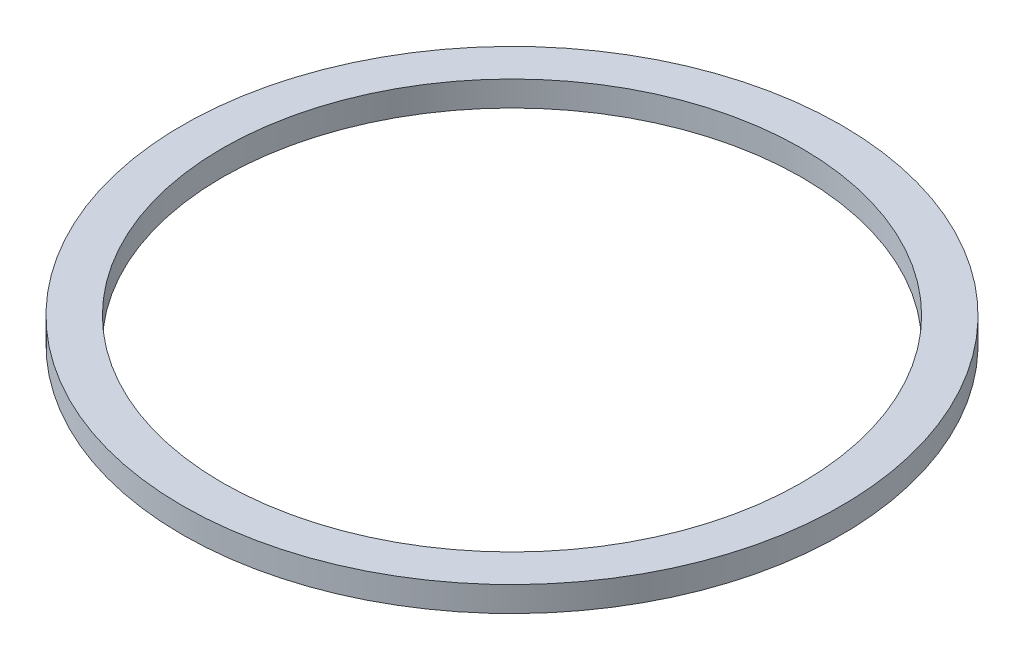
from build123d import *

# Parameters (mm, degrees)
SKETCH1_R           = 111.5
SKETCH1_R_2         = 98
BOSS_EXTRUDE1_DEPTH = 8.5


with BuildPart() as part:
    # Sketch1 → Boss-Extrude1 (new body)
    with BuildSketch(Plane(origin=(0, 0, 0), x_dir=(1, 0, 0), z_dir=(0, 1, 0))):
        Circle(SKETCH1_R)
        Circle(SKETCH1_R_2, mode=Mode.SUBTRACT)
    extrude(amount=BOSS_EXTRUDE1_DEPTH)


solid = part.part
